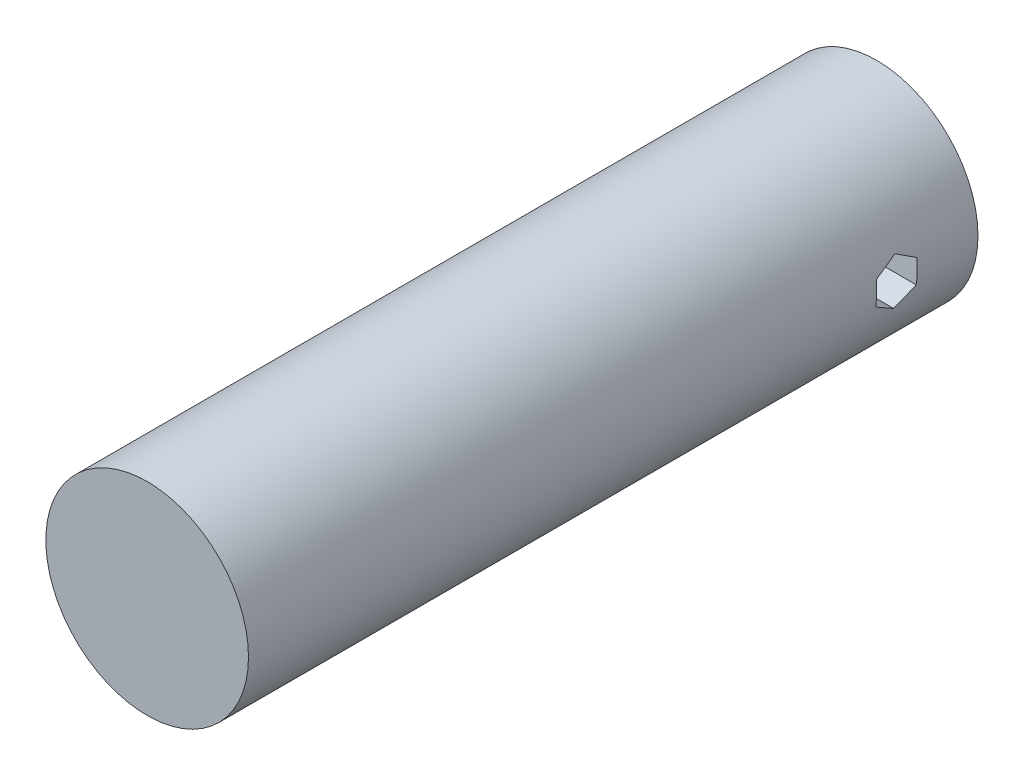
from build123d import *

# Parameters (mm, degrees)
SKETCH1_R           = 6.25
BOSS_EXTRUDE1_DEPTH = 45
CUT_EXTRUDE1_DEPTH  = 10
CUT_EXTRUDE2_DEPTH  = 46.997376012


with BuildPart() as part:
    # Sketch1 → Boss-Extrude1 (new body)
    with BuildSketch(Plane.XY):
        Circle(SKETCH1_R)
    extrude(amount=BOSS_EXTRUDE1_DEPTH)

    # Sketch2 → Cut-Extrude1 (cut)
    with BuildSketch(Plane(origin=(0, 0, 0), x_dir=(-1, 0, 0), z_dir=(0, 0, -1))):
        with BuildLine():
            Line((-0.94, 1.535057002), (-0.94, -1.535057002))
            ThreePointArc((-0.94, -1.535057002), (1.8, 0), (-0.94, 1.535057002))
        make_face()
    extrude(amount=-CUT_EXTRUDE1_DEPTH, mode=Mode.SUBTRACT)

    # Sketch3 → Cut-Extrude2 (cut, through all)
    with BuildSketch(Plane.ZY.offset(-0.94)):
        Polygon((6.230708553, 0.754115238), (4.962271323, 1.44288249), (3.73156277, 0.688767252), (3.769291447, -0.754115238), (5.037728677, -1.44288249), (6.26843723, -0.688767252), align=None)
    extrude(amount=-CUT_EXTRUDE2_DEPTH, mode=Mode.SUBTRACT)


solid = part.part
